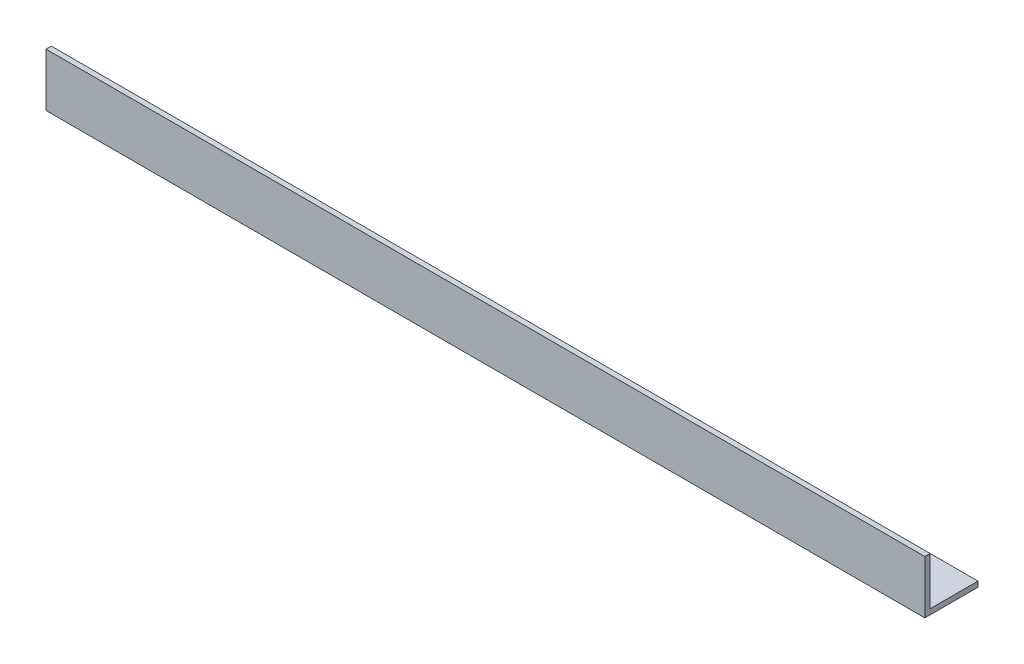
from build123d import *

# Parameters (mm, degrees)
EXTRUDE_1_DEPTH = 496


with BuildPart() as part:
    # Эскиз1 → Вытянуть-Тонкостенный1 (new body)
    with BuildSketch(Plane(origin=(0, 0, 0), x_dir=(0, 0, -1), z_dir=(1, 0, 0))):
        Polygon((0, 30), (0, 0), (30, 0), (30, 3), (3, 3), (3, 30), align=None)
    extrude(amount=EXTRUDE_1_DEPTH)


solid = part.part
